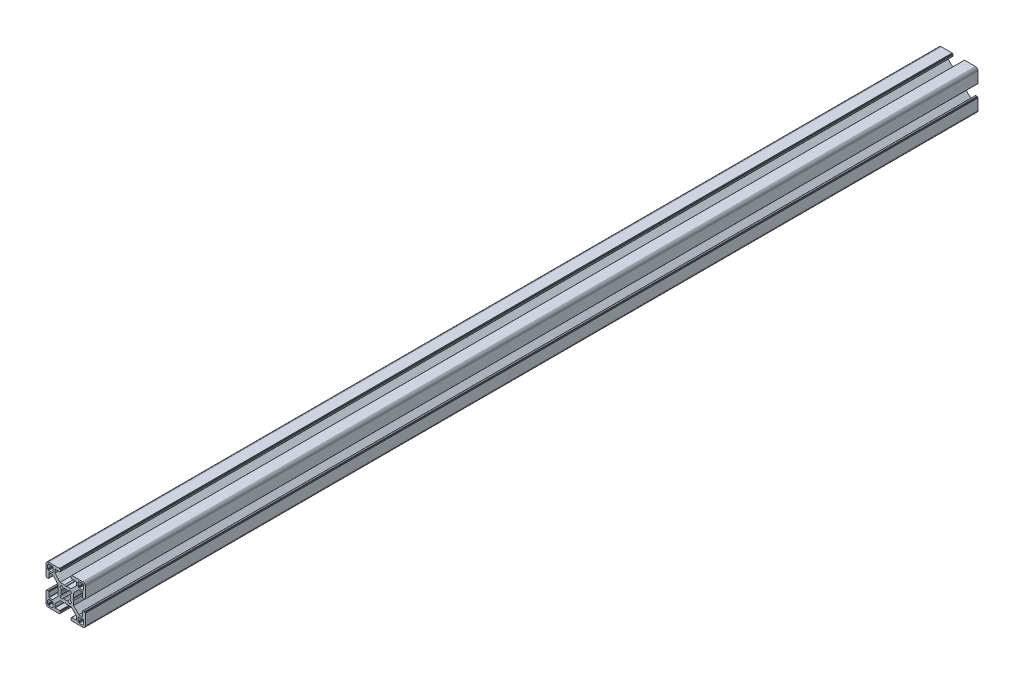
from build123d import *

# Parameters (mm, degrees)
BOSS_EXTRUDE1_DEPTH = 680


with BuildPart() as part:
    # Sketch1 → Boss-Extrude1 (new body)
    with BuildSketch(Plane.XY):
        Polygon((28.34729664, 29.969613999), (28.000000864, 29.999999329), (19.750000909, 29.999999329), (19.715268165, 29.996961355), (19.681595266, 29.987938702), (19.649999216, 29.973205179), (19.621443003, 29.953207821), (19.596790895, 29.928557575), (19.576793537, 29.899999499), (19.562061876, 29.868405312), (19.55303736, 29.834728688), (19.549999386, 29.799999669), (19.549999386, 29.699999839), (19.546961412, 29.665268958), (19.537936896, 29.631596059), (19.523203373, 29.599998146), (19.503207877, 29.571441934), (19.478557631, 29.546789825), (19.449999556, 29.526794329), (19.418403506, 29.512060806), (19.384728745, 29.503038153), (19.349999726, 29.500000179), (19.249999896, 29.500000179), (19.215267517, 29.496958527), (19.181592755, 29.487935874), (19.149996706, 29.47320235), (19.12143863, 29.453206855), (19.096788384, 29.428554746), (19.076791026, 29.399996671), (19.062057503, 29.368402484), (19.05303485, 29.334725859), (19.049996876, 29.299998703), (19.049996876, 28.39999837), (19.059110798, 28.29580945), (19.08618062, 28.194785165), (19.13038119, 28.099997016), (19.190369539, 28.014324653), (19.264324002, 27.94037019), (19.349996366, 27.88038184), (19.444784515, 27.836181271), (19.545806937, 27.809111449), (19.650010894, 27.799984574), (23.050010706, 27.799984574), (23.084741588, 27.7969466), (23.118414487, 27.787923946), (23.150012399, 27.773190423), (23.178568612, 27.753193065), (23.203220721, 27.728542819), (23.223218079, 27.699984744), (23.237949739, 27.668386831), (23.246974255, 27.634713932), (23.25001142, 27.59998608), (23.25001142, 25.049987618), (19.204474482, 20.999982084), (15.900007876, 20.999982084), (15.000008474, 20.48483404), (14.10000814, 20.999982084), (10.795543398, 20.999982084), (7.997342887, 23.801274731), (6.750011387, 25.049984589), (6.750011387, 27.599983051), (6.753049362, 27.634713932), (6.762072946, 27.668386831), (6.776805538, 27.699984744), (6.796801965, 27.728542819), (6.821454073, 27.753193065), (6.850011218, 27.773190423), (6.881607267, 27.787923946), (6.915282029, 27.7969466), (6.950011048, 27.799984574), (10.350011791, 27.799984574), (10.45420071, 27.809098497), (10.555223133, 27.836168318), (10.650011282, 27.880368888), (10.735683645, 27.940357238), (10.809638108, 28.014311701), (10.869626458, 28.099984064), (10.913827027, 28.194772213), (10.940895918, 28.295796498), (10.950010772, 28.399985417), (10.950010772, 29.299985751), (10.946974575, 29.334739239), (10.93795065, 29.368415522), (10.923215933, 29.400009153), (10.903218427, 29.428566473), (10.878566319, 29.45321765), (10.849999264, 29.473204166), (10.818403214, 29.487937689), (10.784728453, 29.496960342), (10.749999434, 29.500000179), (10.649999604, 29.500000179), (10.615270585, 29.503038153), (10.581595823, 29.512060806), (10.549999774, 29.526794329), (10.521441698, 29.546789825), (10.496791452, 29.571441934), (10.476795025, 29.599998146), (10.462061502, 29.631596059), (10.453037918, 29.665268958), (10.449999943, 29.699999839), (10.449999943, 29.799999669), (10.446961969, 29.834728688), (10.437938385, 29.868405312), (10.423205793, 29.899999499), (10.403208435, 29.928557575), (10.378557257, 29.953207821), (10.350000113, 29.973205179), (10.318404064, 29.987938702), (10.284729302, 29.996961355), (10.250000283, 29.999999329), (1.999999397, 29.999999329), (1.652702689, 29.969613999), (1.315958682, 29.879383743), (0.999999233, 29.732050374), (0.714424066, 29.532089829), (0.467910431, 29.285576195), (0.267948955, 28.999999166), (0.120614655, 28.684040532), (0.030384399, 28.34729664), (0, 28.000000864), (0, 19.750000909), (0.003037974, 19.715268165), (0.012061559, 19.681595266), (0.026795082, 19.649999216), (0.046790577, 19.621441141), (0.071442686, 19.596789032), (0.09999983, 19.576793537), (0.13159588, 19.562060013), (0.165270641, 19.55303736), (0.19999966, 19.549999386), (0.299999461, 19.549999386), (0.334728509, 19.546959549), (0.368403242, 19.537936896), (0.399999321, 19.523203373), (0.428556465, 19.503207877), (0.453208573, 19.478555769), (0.473204069, 19.449997693), (0.487937592, 19.418403506), (0.496961176, 19.384728745), (0.499999151, 19.349999726), (0.499999151, 19.249998033), (0.503038056, 19.215269014), (0.512060709, 19.181594253), (0.526794232, 19.150000066), (0.546790194, 19.121441524), (0.571441837, 19.096789882), (0.60000029, 19.076794925), (0.631595686, 19.062061999), (0.665270619, 19.053039982), (0.700000626, 19.050000801), (1.60000096, 19.050000801), (1.704189879, 19.059116587), (1.805213233, 19.086186409), (1.90000045, 19.130385115), (1.985673745, 19.190375328), (2.059627277, 19.264327928), (2.119616325, 19.350002154), (2.163816196, 19.444788441), (2.190886018, 19.545812726), (2.200000872, 19.650001645), (2.200000872, 23.050001457), (2.203039777, 23.084732338), (2.212062431, 23.118405237), (2.226795954, 23.15000315), (2.246792381, 23.178559362), (2.271443558, 23.203211471), (2.300000702, 23.223206967), (2.331596752, 23.23794049), (2.365271513, 23.246965006), (2.400001464, 23.250001117), (4.950000857, 23.250001117), (7.997332093, 20.202670812), (8.995535423, 19.204467788), (8.995535423, 15.900001182), (9.515148227, 15.00000178), (8.995535423, 14.100002378), (8.995535423, 10.795536704), (4.950000857, 6.750002138), (2.400001464, 6.750002138), (2.365271513, 6.753040112), (2.331596752, 6.762063697), (2.300000702, 6.77679722), (2.271443558, 6.796793647), (2.246792381, 6.821444824), (2.226795954, 6.850001968), (2.212062431, 6.881598018), (2.203039777, 6.915272779), (2.200000872, 6.950002729), (2.200000872, 10.350002542), (2.190896812, 10.454174265), (2.16382699, 10.555197618), (2.119627119, 10.649984836), (2.059638071, 10.735658131), (1.985684539, 10.809611663), (1.900011244, 10.869600944), (1.805224027, 10.913800582), (1.704200673, 10.940870404), (1.600011754, 10.949986189), (0.70001142, 10.949986189), (0.665281355, 10.946948596), (0.631606253, 10.937926283), (0.600010578, 10.923193954), (0.571451747, 10.903199537), (0.546799638, 10.87854836), (0.526794232, 10.850000195), (0.512060709, 10.818404146), (0.503038056, 10.784730315), (0.499999151, 10.750000365), (0.499999151, 10.650000535), (0.496961176, 10.615270585), (0.487937592, 10.581596754), (0.473204069, 10.550000705), (0.453208573, 10.521443561), (0.428556465, 10.496791452), (0.399999321, 10.476795956), (0.368403242, 10.462062433), (0.334728509, 10.453038849), (0.299999461, 10.449999943), (0.19999966, 10.449999943), (0.165270641, 10.446961969), (0.13159588, 10.437939316), (0.09999983, 10.423205793), (0.071442686, 10.403209366), (0.046790577, 10.378558189), (0.026795082, 10.350000113), (0.012061559, 10.318404064), (0.003037974, 10.284729302), (0, 10.250000283), (0, 1.999999397), (0.030384399, 1.652702689), (0.120614655, 1.315958682), (0.267948955, 0.999999233), (0.467910431, 0.714424066), (0.714424066, 0.467910431), (0.999999233, 0.267948955), (1.315958682, 0.120614655), (1.652702689, 0.030384399), (1.999999397, 0), (10.250000283, 0), (10.284729302, 0.003037974), (10.318404064, 0.012061559), (10.350000113, 0.026795082), (10.378557257, 0.046790577), (10.403208435, 0.071442686), (10.423205793, 0.09999983), (10.437938385, 0.13159588), (10.446961969, 0.165270641), (10.449999943, 0.19999966), (10.449999943, 0.300000422), (10.453037918, 0.334729441), (10.462061502, 0.368404202), (10.476795025, 0.400000252), (10.496791452, 0.428557396), (10.521441698, 0.453208573), (10.549999774, 0.473205), (10.581595823, 0.487938523), (10.615270585, 0.496961176), (10.649999604, 0.500000082), (10.749999434, 0.500000082), (10.784728453, 0.503038056), (10.818403214, 0.512060709), (10.849999264, 0.526794232), (10.878547894, 0.546800104), (10.903198606, 0.571451747), (10.923194493, 0.6000102), (10.93792742, 0.631606528), (10.946949437, 0.66528146), (10.950010772, 0.699984975), (10.950010772, 1.599985308), (10.940895918, 1.704174228), (10.913827027, 1.805197581), (10.869626458, 1.89998573), (10.809638108, 1.985658094), (10.735683645, 2.059612557), (10.650011282, 2.119600674), (10.555223133, 2.163801476), (10.45420071, 2.190870367), (10.350011791, 2.199985221), (6.950011048, 2.199985221), (6.915282029, 2.203024126), (6.881607267, 2.212046779), (6.850011218, 2.226780302), (6.821454073, 2.246776729), (6.796801965, 2.271427907), (6.776805538, 2.299985982), (6.762072946, 2.331582032), (6.753049362, 2.365256793), (6.750011387, 2.399985812), (6.750011387, 4.949985206), (9.787457566, 7.990785077), (10.795545277, 8.999985833), (14.100010019, 8.999985833), (15.000010353, 9.515133877), (15.900009756, 8.999985833), (19.204476361, 8.999985833), (20.21256413, 7.990786065), (23.25001142, 4.949988235), (23.25001142, 2.399988841), (23.246974255, 2.365256793), (23.237949739, 2.331582032), (23.223218079, 2.299985982), (23.203220721, 2.271427907), (23.178568612, 2.246776729), (23.150012399, 2.226780302), (23.118414487, 2.212046779), (23.084741588, 2.203024126), (23.050010706, 2.199985221), (19.650010894, 2.199985221), (19.545806937, 2.190883319), (19.444784515, 2.163814428), (19.349996366, 2.119613626), (19.264324002, 2.059625509), (19.190369539, 1.985671046), (19.13038119, 1.899998682), (19.08618062, 1.805210533), (19.059110798, 1.70418718), (19.049996876, 1.599998261), (19.049996876, 0.699997927), (19.053035506, 0.665268966), (19.062058795, 0.631594374), (19.076792915, 0.599998603), (19.096790813, 0.571440905), (19.121441524, 0.546790194), (19.149999978, 0.526794306), (19.181596306, 0.51206138), (19.215271238, 0.503039363), (19.249999896, 0.500000082), (19.349999726, 0.500000082), (19.384728745, 0.496961176), (19.418403506, 0.487938523), (19.449999556, 0.473205), (19.478557631, 0.453208573), (19.503207877, 0.428557396), (19.523203373, 0.400000252), (19.537936896, 0.368404202), (19.546961412, 0.334729441), (19.549999386, 0.300000422), (19.549999386, 0.19999966), (19.55303736, 0.165270641), (19.562061876, 0.13159588), (19.576793537, 0.09999983), (19.596789964, 0.071441755), (19.621442072, 0.046789646), (19.649998285, 0.02679415), (19.681594335, 0.012060627), (19.715267234, 0.003037043), (19.750000909, 0), (28.000000864, 0), (28.34729664, 0.030384399), (28.684040532, 0.120614655), (28.999999166, 0.267948955), (29.285576195, 0.467910431), (29.532089829, 0.714424066), (29.732050374, 0.999999233), (29.879383743, 1.315958682), (29.969613999, 1.652702689), (29.999999329, 1.999999397), (29.999999329, 10.250000283), (29.996974806, 10.284715361), (29.987951516, 10.318389952), (29.973217396, 10.349985723), (29.953219499, 10.378543421), (29.928568787, 10.403194133), (29.899999499, 10.423205793), (29.868405312, 10.437939316), (29.834728688, 10.446961969), (29.799999669, 10.449999943), (29.699999839, 10.449999943), (29.664909937, 10.453400043), (29.631233313, 10.462423628), (29.599637263, 10.477157151), (29.57108105, 10.497152646), (29.546427079, 10.521804755), (29.526433446, 10.550361899), (29.511699923, 10.581957949), (29.502675407, 10.615631779), (29.499637433, 10.650361729), (29.499637433, 10.750361559), (29.49697202, 10.784715548), (29.487949367, 10.818389378), (29.473215844, 10.849985428), (29.453220348, 10.878542572), (29.428568239, 10.90319468), (29.400010164, 10.923190176), (29.368415977, 10.937923699), (29.334741215, 10.946947284), (29.300012197, 10.949986189), (28.400011863, 10.949986189), (28.29581215, 10.9408876), (28.194787865, 10.913817778), (28.099999716, 10.86961814), (28.014327352, 10.809628859), (27.940374752, 10.735675327), (27.880384539, 10.650002032), (27.836185833, 10.555214814), (27.809114148, 10.454191461), (27.800000225, 10.350002542), (27.800000225, 6.950002729), (27.796962251, 6.915272779), (27.787939598, 6.881598018), (27.773206075, 6.850001968), (27.753208716, 6.821444824), (27.728558471, 6.796793647), (27.700000395, 6.77679722), (27.668404345, 6.762063697), (27.634729584, 6.753040112), (27.599998702, 6.750002138), (25.05000024, 6.750002138), (23.809199132, 7.99080223), (21.004464477, 10.795534588), (21.004464477, 14.100000262), (20.484851673, 14.999999665), (21.004464477, 15.899999067), (21.004464477, 19.204465672), (25.05000024, 23.250001117), (27.599998702, 23.250001117), (27.634729584, 23.246965006), (27.668404345, 23.23794049), (27.700000395, 23.223206967), (27.728558471, 23.203211471), (27.753208716, 23.178559362), (27.773206075, 23.15000315), (27.787939598, 23.118405237), (27.796962251, 23.084732338), (27.800000225, 23.050001457), (27.800000225, 19.650001645), (27.809114148, 19.545812726), (27.836185833, 19.444788441), (27.880384539, 19.350002154), (27.940370508, 19.264323684), (28.014323108, 19.190371084), (28.099995472, 19.130380872), (28.194783621, 19.086182165), (28.295807906, 19.059112343), (28.400001069, 19.050000801), (29.300001402, 19.050000801), (29.334730421, 19.053040638), (29.368405183, 19.062063291), (29.39999937, 19.076796814), (29.42819671, 19.097149726), (29.452848353, 19.1218023), (29.472843309, 19.150360754), (29.487576235, 19.181955219), (29.496598252, 19.215630151), (29.499637433, 19.250359227), (29.499637433, 19.35036092), (29.502675407, 19.385089939), (29.511699923, 19.4187647), (29.526433446, 19.450358887), (29.546427079, 19.478916963), (29.57108105, 19.503569071), (29.599637263, 19.523564567), (29.631233313, 19.53829809), (29.664909937, 19.547320743), (29.699999839, 19.549999386), (29.799999669, 19.549999386), (29.834728688, 19.55303736), (29.868405312, 19.562060013), (29.899999499, 19.576793537), (29.928557575, 19.596789032), (29.953207821, 19.621441141), (29.973205179, 19.649999216), (29.987938702, 19.681595266), (29.996961355, 19.715268165), (29.999999329, 19.750000909), (29.999999329, 28.000000864), (29.969613999, 28.34729664), (29.879383743, 28.684040532), (29.732050374, 28.999999166), (29.532089829, 29.285576195), (29.285576195, 29.532089829), (28.999999166, 29.732050374), (28.684040532, 29.879383743), align=None)
        Polygon((1.299998723, 25.499999523), (1.299998723, 27.699999511), (1.312309876, 27.856435627), (1.348942518, 28.009016067), (1.408992335, 28.153989464), (1.490981318, 28.287785128), (1.592892222, 28.407108039), (1.71221327, 28.50901708), (1.846008119, 28.591006994), (1.9909814, 28.651056811), (2.143563703, 28.687689453), (2.299998887, 28.699999675), (4.499998875, 28.699999675), (4.656434059, 28.687689453), (4.809016362, 28.651056811), (4.953989759, 28.591006994), (5.087784491, 28.50901708), (5.207106471, 28.407108039), (5.309016444, 28.287785128), (5.391005427, 28.153989464), (5.451056175, 28.009016067), (5.487687886, 27.856435627), (5.499999039, 27.699999511), (5.499999039, 25.499999523), (5.487687886, 25.34356527), (5.451056175, 25.190982968), (5.391005427, 25.04600957), (5.309016444, 24.912213907), (5.207106471, 24.792892858), (5.087784491, 24.690981954), (4.953989759, 24.60899204), (4.809016362, 24.548944086), (4.656434059, 24.512309581), (4.499998875, 24.499999359), (2.299998887, 24.499999359), (2.143563703, 24.512309581), (1.9909814, 24.548944086), (1.846008119, 24.60899204), (1.71221327, 24.690981954), (1.592892222, 24.792892858), (1.490981318, 24.912213907), (1.408992335, 25.04600957), (1.348942518, 25.190982968), (1.312309876, 25.34356527), align=None, mode=Mode.SUBTRACT)
        Polygon((25.34356527, 28.687689453), (25.499999523, 28.699999675), (27.699999511, 28.699999675), (27.856435627, 28.687689453), (28.009017929, 28.651056811), (28.153991327, 28.591006994), (28.28778699, 28.50901708), (28.407108039, 28.407108039), (28.50901708, 28.287785128), (28.591006994, 28.153989464), (28.651056811, 28.009016067), (28.687689453, 27.856435627), (28.700001538, 27.699999511), (28.700001538, 25.499999523), (28.687689453, 25.34356527), (28.651056811, 25.190982968), (28.591006994, 25.04600957), (28.50901708, 24.912213907), (28.407108039, 24.792892858), (28.28778699, 24.690981954), (28.153991327, 24.60899204), (28.009017929, 24.548944086), (27.856435627, 24.512309581), (27.699999511, 24.499999359), (25.499999523, 24.499999359), (25.34356527, 24.512309581), (25.190982968, 24.548944086), (25.04600957, 24.60899204), (24.912215769, 24.690981954), (24.792892858, 24.792892858), (24.690981954, 24.912213907), (24.608993903, 25.04600957), (24.548944086, 25.190982968), (24.512311444, 25.34356527), (24.500001222, 25.499999523), (24.500001222, 27.699999511), (24.512311444, 27.856435627), (24.548944086, 28.009016067), (24.608993903, 28.153989464), (24.690981954, 28.287785128), (24.792892858, 28.407108039), (24.912215769, 28.50901708), (25.04600957, 28.591006994), (25.190982968, 28.651056811), align=None, mode=Mode.SUBTRACT)
        Polygon((14.999999665, 18.649999052), (15.550030395, 18.608318642), (16.087498516, 18.484227359), (16.600128263, 18.280562013), (18.13592948, 19.518401474), (18.644984812, 19.11874488), (19.103571773, 18.662061542), (19.505336881, 18.154669553), (18.280562013, 16.600130126), (18.484227359, 16.087498516), (18.608318642, 15.550030395), (18.649999052, 14.999999665), (18.608318642, 14.449968934), (18.484227359, 13.912500814), (18.280562013, 13.399870135), (19.505336881, 11.845329776), (19.103571773, 11.337937787), (18.644984812, 10.881252587), (18.13592948, 10.481598787), (16.600128263, 11.719437316), (16.087498516, 11.515771039), (15.550030395, 11.391680688), (14.999999665, 11.349999346), (14.449968934, 11.391680688), (13.912500814, 11.515771039), (13.399870135, 11.719437316), (11.864069849, 10.481598787), (11.355013587, 10.881252587), (10.896427557, 11.337937787), (10.494662449, 11.845329776), (11.719438247, 13.399870135), (11.515771039, 13.912500814), (11.391680688, 14.449968934), (11.349999346, 14.999999665), (11.391680688, 15.550030395), (11.515771039, 16.087498516), (11.719438247, 16.600130126), (10.494662449, 18.154669553), (10.896427557, 18.662061542), (11.355013587, 19.11874488), (11.864069849, 19.518401474), (13.399870135, 18.280562013), (13.912500814, 18.484227359), (14.449968934, 18.608318642), align=None, mode=Mode.SUBTRACT)
        Polygon((4.499998875, 1.299999771), (2.299998887, 1.299999771), (2.143563703, 1.312310807), (1.9909814, 1.348942518), (1.846008119, 1.408992335), (1.71221327, 1.490982249), (1.592892222, 1.592892222), (1.490981318, 1.712214202), (1.408992335, 1.846008934), (1.348942518, 1.990982331), (1.312309876, 2.143564634), (1.299998723, 2.299998887), (1.299998723, 4.499999806), (1.312309876, 4.656434059), (1.348942518, 4.809017293), (1.408992335, 4.95399069), (1.490981318, 5.087785423), (1.592892222, 5.207106471), (1.71221327, 5.309017375), (1.846008119, 5.391006358), (1.9909814, 5.451056175), (2.143563703, 5.487688817), (2.299998887, 5.49999997), (4.499998875, 5.49999997), (4.656434059, 5.487688817), (4.809016362, 5.451056175), (4.953989759, 5.391006358), (5.087784491, 5.309017375), (5.207106471, 5.207106471), (5.309016444, 5.087785423), (5.391005427, 4.95399069), (5.451056175, 4.809017293), (5.487687886, 4.656434059), (5.499999039, 4.499999806), (5.499999039, 2.299998887), (5.487687886, 2.143564634), (5.451056175, 1.990982331), (5.391005427, 1.846008934), (5.309016444, 1.712214202), (5.207106471, 1.592892222), (5.087784491, 1.490982249), (4.953989759, 1.408992335), (4.809016362, 1.348942518), (4.656434059, 1.312310807), align=None, mode=Mode.SUBTRACT)
        Polygon((27.699999511, 1.299999771), (25.499999523, 1.299999771), (25.34356527, 1.312310807), (25.190982968, 1.348942518), (25.04600957, 1.408992335), (24.912215769, 1.490982249), (24.792892858, 1.592892222), (24.690981954, 1.712214202), (24.608993903, 1.846008934), (24.548944086, 1.990982331), (24.512311444, 2.143564634), (24.500001222, 2.299998887), (24.500001222, 4.499999806), (24.512311444, 4.656434059), (24.548944086, 4.809017293), (24.608993903, 4.95399069), (24.690981954, 5.087785423), (24.792892858, 5.207106471), (24.912215769, 5.309017375), (25.04600957, 5.391006358), (25.190982968, 5.451056175), (25.34356527, 5.487688817), (25.499999523, 5.49999997), (27.699999511, 5.49999997), (27.856435627, 5.487688817), (28.009017929, 5.451056175), (28.153991327, 5.391006358), (28.28778699, 5.309017375), (28.407108039, 5.207106471), (28.50901708, 5.087785423), (28.591006994, 4.95399069), (28.651056811, 4.809017293), (28.687689453, 4.656434059), (28.700001538, 4.499999806), (28.700001538, 2.299998887), (28.687689453, 2.143564634), (28.651056811, 1.990982331), (28.591006994, 1.846008934), (28.50901708, 1.712214202), (28.407108039, 1.592892222), (28.28778699, 1.490982249), (28.153991327, 1.408992335), (28.009017929, 1.348942518), (27.856435627, 1.312310807), align=None, mode=Mode.SUBTRACT)
    extrude(amount=-BOSS_EXTRUDE1_DEPTH)


solid = part.part
